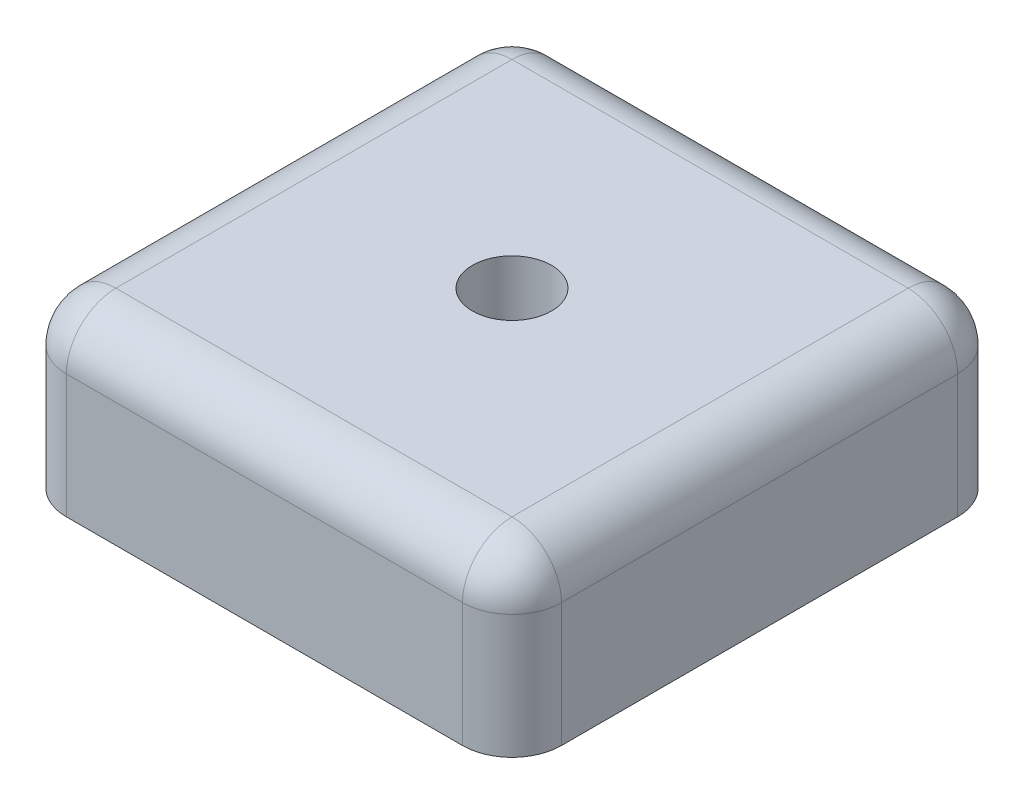
from build123d import *

# Parameters (mm, degrees)
SKETCH2_W           = 20
SKETCH2_H           = 20
BOSS_EXTRUDE1_DEPTH = 7
SKETCH3_R           = 1.6
CUT_EXTRUDE1_DEPTH  = 30.137604569
FILLET1_R           = 2


with BuildPart() as part:
    # Sketch2 → Boss-Extrude1 (new body)
    with BuildSketch(Plane(origin=(0, 0, 0), x_dir=(1, 0, 0), z_dir=(0, 1, 0))):
        with Locations((10, 10)):
            Rectangle(SKETCH2_W, SKETCH2_H)
    extrude(amount=BOSS_EXTRUDE1_DEPTH)

    # Sketch3 → Cut-Extrude1 (cut, through all)
    with BuildSketch(Plane(origin=(0, 7, 0), x_dir=(1, 0, 0), z_dir=(0, 1, 0))):
        with Locations((10, 10)):
            Circle(SKETCH3_R)
    extrude(amount=-CUT_EXTRUDE1_DEPTH, mode=Mode.SUBTRACT)

    # Fillet1
    fillet1_edges = [part.edges().sort_by_distance(p)[0] for p in [
        (0, 3.5, -20),
        (20, 3.5, -20),
        (20, 3.5, 0),
        (0, 3.5, 0),
        (10, 7, 0),
        (20, 7, -10),
        (10, 7, -20),
        (0, 7, -10),
    ]]
    fillet(fillet1_edges, radius=FILLET1_R)


solid = part.part
